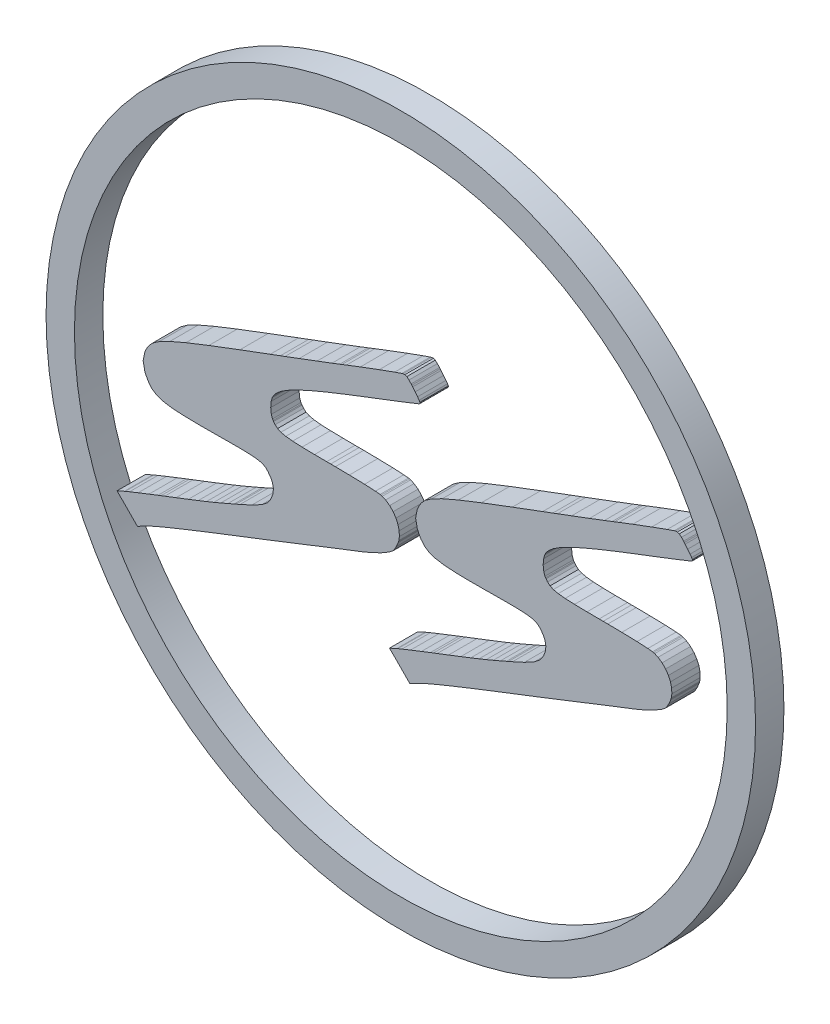
from build123d import *

# Parameters (mm, degrees)
AUFSATZ_LINEAR_AUSTRAGEN1_DEPTH       = 5
AUFSATZ_LINEAR_AUSTRAGEN1_2_DEPTH     = 5
AUFSATZ_LINEAR_AUSTRAGEN2_OUTLINE_R   = 62.5
AUFSATZ_LINEAR_AUSTRAGEN2_OUTLINE_R_2 = 57.5
AUFSATZ_LINEAR_AUSTRAGEN2_DEPTH       = 5


# Read off the part's stored shape, not the designer's step: Aufsatz-Linear austragen2
with BuildPart() as part:
    # Skizze1 → Aufsatz-Linear austragen1 (new body)
    with BuildSketch(Plane.XY):
        Polygon((16.2714138, 23.9861344), (14.4758116, 25.795478), (15.7643028, 26.368756), (15.9406804, 26.448766), (16.6710574, 26.747724), (18.1910188, 27.355546), (20.1078806, 28.107894), (21.6857032, 28.72105), (22.2135152, 28.922218), (22.8790968, 29.178504), (24.880058, 29.947616), (27.032454, 30.77845), (28.781244, 31.461964), (30.240474, 32.0421), (31.523428, 32.564324), (32.743136, 33.075626), (34.009326, 33.619948), (35.08146, 34.087054), (35.439854, 34.242756), (36.141148, 34.550096), (38.230552, 35.507676), (39.958768, 36.428426), (40.952162, 37.215318), (41.426126, 37.846254), (41.546268, 38.075362), (41.660568, 38.295834), (41.919394, 38.999922), (42.02836, 39.854378), (41.872404, 40.672766), (41.579034, 41.298368), (41.452288, 41.487344), (41.358562, 41.626282), (41.058334, 42.032682), (40.643298, 42.446194), (40.1005, 42.742612), (39.330118, 42.94124), (38.223694, 43.059604), (36.681406, 43.114722), (34.597844, 43.12285), (32.55162, 43.110404), (31.8709, 43.1038), (31.050988, 43.096688), (28.590998, 43.093894), (26.00731, 43.146472), (24.01595, 43.28414), (22.5235476, 43.531028), (21.426674, 43.911266), (20.63013, 44.448476), (20.0334332, 45.166534), (19.6476072, 45.853096), (19.5387428, 46.089824), (19.3830154, 46.42485), (19.0743546, 47.943262), (19.3844124, 49.460404), (19.5401144, 49.793906), (19.6434924, 50.017172), (20.011386, 50.660554), (20.7155756, 51.450494), (21.8910622, 52.2732), (23.778968, 53.240432), (26.617672, 54.465728), (30.649922, 56.057038), (36.112446, 58.127138), (41.46321, 60.123832), (43.248068, 60.786772), (44.075854, 61.095382), (46.559212, 62.02299), (49.70805, 63.206376), (52.338728, 64.202818), (53.694834, 64.722248), (54.0959, 64.87795), (54.903366, 65.195196), (57.33821, 66.12636), (60.663578, 67.37096), (63.388998, 68.358766), (64.64325, 68.793106), (64.83756, 68.841366), (64.922904, 68.86321), (65.19316, 68.874132), (65.527932, 68.750434), (65.908424, 68.427854), (66.281804, 68.008754), (66.400422, 67.864228), (66.546472, 67.684904), (66.98894, 67.1449), (67.416168, 66.614294), (67.693028, 66.239644), (67.83349, 65.985898), (67.85, 65.820544), (67.756274, 65.707768), (67.564504, 65.615312), (67.356732, 65.534032), (67.287644, 65.5066), (66.900802, 65.352168), (65.737482, 64.891666), (63.816226, 64.140588), (61.688722, 63.319406), (60.061344, 62.695328), (59.519816, 62.488572), (58.40374, 62.064138), (55.060338, 60.774072), (51.408834, 59.3217), (48.481738, 58.0898), (46.199548, 57.041034), (44.484032, 56.137048), (43.251878, 55.33771), (42.425362, 54.603396), (42.022772, 54.086506), (41.924982, 53.89499), (41.820334, 53.692552), (41.631612, 53.01869), (41.544744, 52.022248), (41.660568, 51.057556), (41.8658, 50.451512), (41.978576, 50.277776), (42.05884, 50.155094), (42.332906, 49.803812), (42.75861, 49.43856), (43.351446, 49.16551), (44.204378, 48.973994), (45.41164, 48.845978), (47.069244, 48.768762), (49.271424, 48.72736), (51.400452, 48.709326), (52.111398, 48.705516), (52.934104, 48.702722), (55.403746, 48.669448), (58.07989, 48.599344), (59.989716, 48.49876), (60.822074, 48.420274), (60.984634, 48.376078), (61.189866, 48.32096), (61.783972, 48.055022), (62.498982, 47.565818), (63.113662, 46.940216), (63.608454, 46.208188), (63.969388, 45.402246), (64.176144, 44.551854), (64.214752, 43.689524), (64.12636, 43.046904), (64.065654, 42.841672), (64.021712, 42.698416), (63.693798, 41.911778), (63.310766, 41.233852), (63.240662, 41.14419), (63.078102, 40.937434), (62.431672, 40.440102), (61.050928, 39.618666), (59.160152, 38.714426), (57.409838, 37.984176), (56.82005, 37.75964), (56.448194, 37.619178), (55.333388, 37.187632), (53.30215, 36.3982), (50.992528, 35.49269), (49.250596, 34.806382), (48.671984, 34.576258), (48.046128, 34.329624), (46.168052, 33.590992), (43.363638, 32.492696), (40.599356, 31.415228), (38.814752, 30.722062), (38.2209, 30.491938), (37.23284, 30.111446), (34.26866, 28.96362), (30.831786, 27.624278), (27.889704, 26.465276), (25.417522, 25.478486), (23.3958598, 24.6558562), (21.8015018, 23.9861344), (20.61362, 23.4638596), (20.0072712, 23.1799638), (19.8101926, 23.0766366), (18.0669906, 22.1753938), align=None)
    extrude(amount=AUFSATZ_LINEAR_AUSTRAGEN1_DEPTH)


with BuildPart() as body_2:
    # Skizze1 → Aufsatz-Linear austragen1 2 (new body)
    with BuildSketch(Plane.XY):
        Polygon((-31.7285862, 23.9861344), (-33.5241884, 25.795478), (-32.2356972, 26.368756), (-32.0593196, 26.448766), (-31.3289426, 26.747724), (-29.8089812, 27.355546), (-27.8921194, 28.107894), (-26.3142968, 28.72105), (-25.7864848, 28.922218), (-25.1209032, 29.178504), (-23.119942, 29.947616), (-20.967546, 30.77845), (-19.218756, 31.461964), (-17.759526, 32.0421), (-16.476572, 32.564324), (-15.256864, 33.075626), (-13.990674, 33.619948), (-12.91854, 34.087054), (-12.560146, 34.242756), (-11.858852, 34.550096), (-9.769448, 35.507676), (-8.041232, 36.428426), (-7.047838, 37.215318), (-6.573874, 37.846254), (-6.453732, 38.075362), (-6.339432, 38.295834), (-6.080606, 38.999922), (-5.97164, 39.854378), (-6.127596, 40.672766), (-6.420966, 41.298368), (-6.547712, 41.487344), (-6.641438, 41.626282), (-6.941666, 42.032682), (-7.356702, 42.446194), (-7.8995, 42.742612), (-8.669882, 42.94124), (-9.776306, 43.059604), (-11.318594, 43.114722), (-13.402156, 43.12285), (-15.44838, 43.110404), (-16.1291, 43.1038), (-16.949012, 43.096688), (-19.409002, 43.093894), (-21.99269, 43.146472), (-23.98405, 43.28414), (-25.4764524, 43.531028), (-26.573326, 43.911266), (-27.36987, 44.448476), (-27.9665668, 45.166534), (-28.3523928, 45.853096), (-28.4612572, 46.089824), (-28.6169846, 46.42485), (-28.9256454, 47.943262), (-28.6155876, 49.460404), (-28.4598856, 49.793906), (-28.3565076, 50.017172), (-27.988614, 50.660554), (-27.2844244, 51.450494), (-26.1089378, 52.2732), (-24.221032, 53.240432), (-21.382328, 54.465728), (-17.350078, 56.057038), (-11.887554, 58.127138), (-6.53679, 60.123832), (-4.751932, 60.786772), (-3.924146, 61.095382), (-1.440788, 62.02299), (1.70805, 63.206376), (4.338728, 64.202818), (5.694834, 64.722248), (6.0959, 64.87795), (6.903366, 65.195196), (9.33821, 66.12636), (12.663578, 67.37096), (15.388998, 68.358766), (16.64325, 68.793106), (16.83756, 68.841366), (16.922904, 68.86321), (17.19316, 68.874132), (17.527932, 68.750434), (17.908424, 68.427854), (18.281804, 68.008754), (18.400422, 67.864228), (18.546472, 67.684904), (18.98894, 67.1449), (19.416168, 66.614294), (19.693028, 66.239644), (19.83349, 65.985898), (19.85, 65.820544), (19.756274, 65.707768), (19.564504, 65.615312), (19.356732, 65.534032), (19.287644, 65.5066), (18.900802, 65.352168), (17.737482, 64.891666), (15.816226, 64.140588), (13.688722, 63.319406), (12.061344, 62.695328), (11.519816, 62.488572), (10.40374, 62.064138), (7.060338, 60.774072), (3.408834, 59.3217), (0.481738, 58.0898), (-1.800452, 57.041034), (-3.515968, 56.137048), (-4.748122, 55.33771), (-5.574638, 54.603396), (-5.977228, 54.086506), (-6.075018, 53.89499), (-6.179666, 53.692552), (-6.368388, 53.01869), (-6.455256, 52.022248), (-6.339432, 51.057556), (-6.1342, 50.451512), (-6.021424, 50.277776), (-5.94116, 50.155094), (-5.667094, 49.803812), (-5.24139, 49.43856), (-4.648554, 49.16551), (-3.795622, 48.973994), (-2.58836, 48.845978), (-0.930756, 48.768762), (1.271424, 48.72736), (3.400452, 48.709326), (4.111398, 48.705516), (4.934104, 48.702722), (7.403746, 48.669448), (10.07989, 48.599344), (11.989716, 48.49876), (12.822074, 48.420274), (12.984634, 48.376078), (13.189866, 48.32096), (13.783972, 48.055022), (14.498982, 47.565818), (15.113662, 46.940216), (15.608454, 46.208188), (15.969388, 45.402246), (16.176144, 44.551854), (16.214752, 43.689524), (16.12636, 43.046904), (16.065654, 42.841672), (16.021712, 42.698416), (15.693798, 41.911778), (15.310766, 41.233852), (15.240662, 41.14419), (15.078102, 40.937434), (14.431672, 40.440102), (13.050928, 39.618666), (11.160152, 38.714426), (9.409838, 37.984176), (8.82005, 37.75964), (8.448194, 37.619178), (7.333388, 37.187632), (5.30215, 36.3982), (2.992528, 35.49269), (1.250596, 34.806382), (0.671984, 34.576258), (0.046128, 34.329624), (-1.831948, 33.590992), (-4.636362, 32.492696), (-7.400644, 31.415228), (-9.185248, 30.722062), (-9.7791, 30.491938), (-10.76716, 30.111446), (-13.73134, 28.96362), (-17.168214, 27.624278), (-20.110296, 26.465276), (-22.582478, 25.478486), (-24.6041402, 24.6558562), (-26.1984982, 23.9861344), (-27.38638, 23.4638596), (-27.9927288, 23.1799638), (-28.1898074, 23.0766366), (-29.9330094, 22.1753938), align=None)
    extrude(amount=AUFSATZ_LINEAR_AUSTRAGEN1_2_DEPTH)


with BuildPart() as body_3:
    # Aufsatz-Linear austragen2 outline → Aufsatz-Linear austragen2 (new body)
    with BuildSketch(Plane.XY):
        with Locations((16.46765633, 46.308120893)):
            Circle(AUFSATZ_LINEAR_AUSTRAGEN2_OUTLINE_R)
        with Locations((16.46765633, 46.308120893)):
            Circle(AUFSATZ_LINEAR_AUSTRAGEN2_OUTLINE_R_2, mode=Mode.SUBTRACT)
    extrude(amount=AUFSATZ_LINEAR_AUSTRAGEN2_DEPTH)


solid = Compound([part.part, body_2.part, body_3.part])
